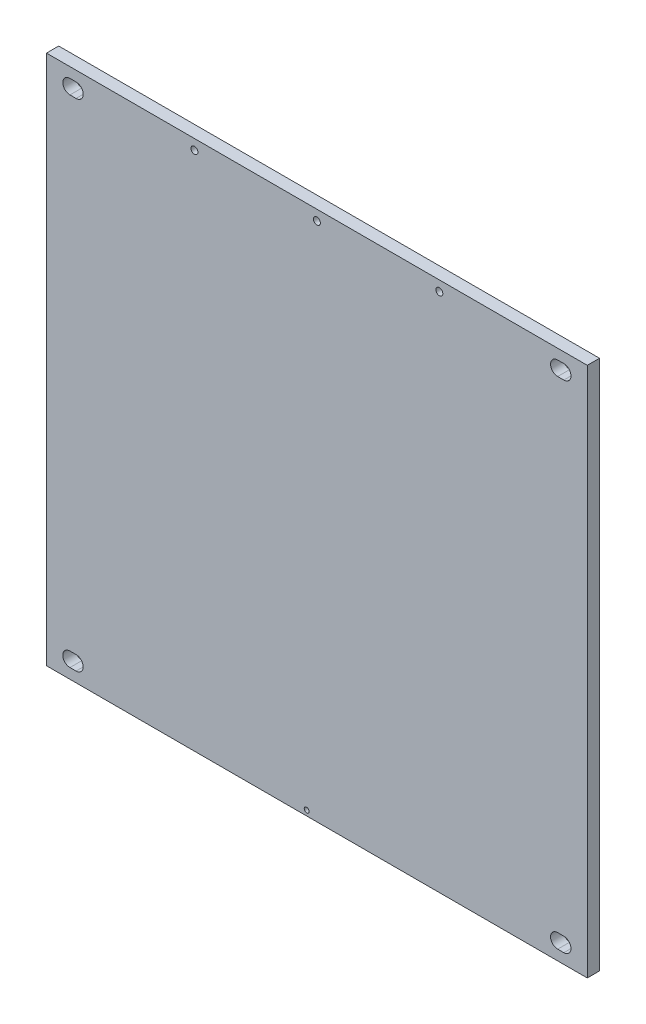
from build123d import *

# Parameters (mm, degrees)
CROQUIS1_W                      = 265
CROQUIS1_H                      = 260
BRIDA_BASE1_DEPTH               = 6
RANURA_START                    = -6
RANURA_DE_MARGEN_PARA_M61_DEPTH = 6
CROQUIS5_R                      = 1.2
CORTAR_EXTRUIR1_DEPTH           = 186.72089274
TALADRO_DE_MARGEN_PARA_M31_D    = 3.4


# Read off the part's stored shape, not the designer's step: Ranura de margen para M61
# Sheet-metal steps are written as plain solids
with BuildPart() as part:
    # Croquis1 → Brida base1 (new body)
    with BuildSketch(Plane.XY):
        Rectangle(CROQUIS1_W, CROQUIS1_H)
    extrude(amount=-BRIDA_BASE1_DEPTH)

    # Ranura de margen para M61 outline → Ranura de margen para M61 (cut)
    with BuildSketch(Plane.XY.offset(RANURA_START)):
        with BuildLine():
            ThreePointArc((-118, 118), (-114.5, 121.5), (-118, 125))
            Line((-118, 125), (-121, 125))
            ThreePointArc((-121, 125), (-124.5, 121.5), (-121, 118))
            Line((-121, 118), (-118, 118))
        make_face()
        with BuildLine():
            ThreePointArc((118, 125), (114.5, 121.5), (118, 118))
            Line((118, 118), (121, 118))
            ThreePointArc((121, 118), (124.5, 121.5), (121, 125))
            Line((121, 125), (118, 125))
        make_face()
        with BuildLine():
            ThreePointArc((121, -125), (124.5, -121.5), (121, -118))
            Line((121, -118), (118, -118))
            ThreePointArc((118, -118), (114.5, -121.5), (118, -125))
            Line((118, -125), (121, -125))
        make_face()
        with BuildLine():
            ThreePointArc((-121, -118), (-124.5, -121.5), (-121, -125))
            Line((-121, -125), (-118, -125))
            ThreePointArc((-118, -125), (-114.5, -121.5), (-118, -118))
            Line((-118, -118), (-121, -118))
        make_face()
    extrude(amount=RANURA_DE_MARGEN_PARA_M61_DEPTH, mode=Mode.SUBTRACT)

    # Croquis5 → Cortar-Extruir1 (cut, through all)
    with BuildSketch(Plane.XY):
        with Locations((-5, -127.5)):
            Circle(CROQUIS5_R)
    extrude(amount=-CORTAR_EXTRUIR1_DEPTH, mode=Mode.SUBTRACT)

    # Taladro de margen para M31 (through all)
    with Locations(Plane.XY):
        with Locations((60, 125), (0, 125), (-60, 125)):
            Hole(TALADRO_DE_MARGEN_PARA_M31_D / 2)


solid = part.part
